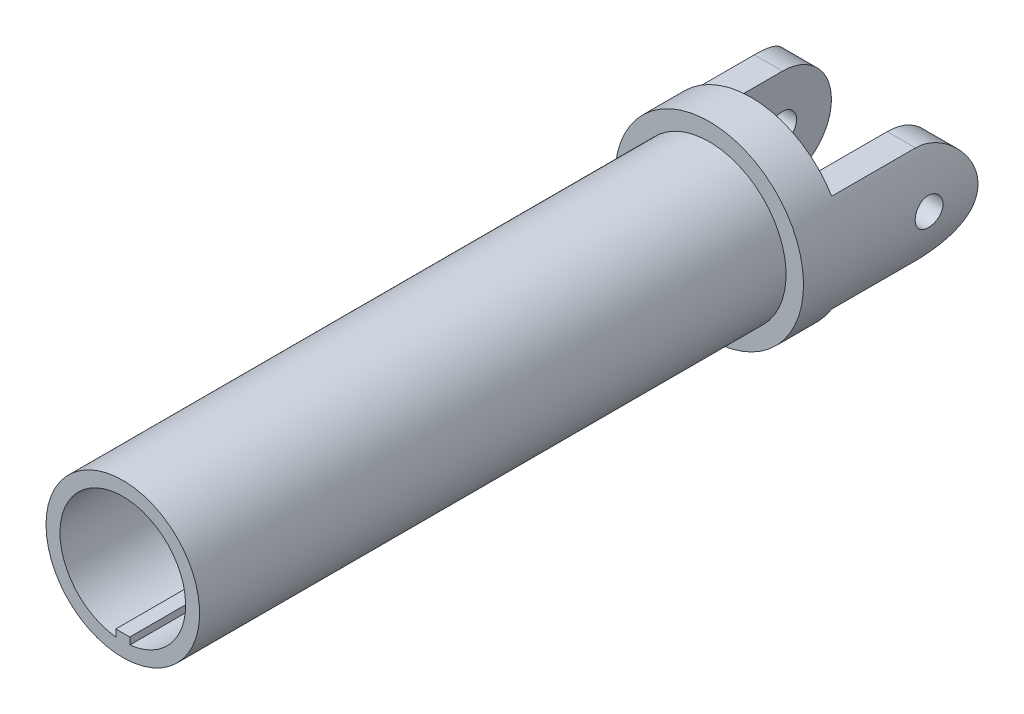
from build123d import *
from build123d.topology import SkipClean

# Parameters (mm, degrees)
SKETCH1_R                = 5.5
YOKE_DEPTH               = 21
SKETCH2_R                = 6.75
U_JOINT_BASE_DEPTH       = 3
U_JOINT_STANDUPS_DEPTH   = 9.5
STANDUP_ROUND_DEPTH      = 35.833532695
STANDUP_ROUND_DEPTH_BACK = 35.833532695
BALL_HOLES_DEPTH         = 35.83353281
BALL_HOLES_DEPTH_BACK    = 35.83353281
SKETCH5_R                = 1
KEYWAY_DEPTH             = 42


with BuildPart() as part:
    # Sketch1 → Yoke (new, symmetric)
    with BuildSketch(Plane.XY):
        Circle(SKETCH1_R)
    extrude(amount=YOKE_DEPTH, both=True)

    # Sketch2 → U Joint Base (add)
    with BuildSketch(Plane(origin=(0, 0, -21), x_dir=(-1, 0, 0), z_dir=(0, 0, -1))):
        Circle(SKETCH2_R)
    extrude(amount=U_JOINT_BASE_DEPTH)

    # Sketch3 → U Joint Standups (add)
    with SkipClean():  # the faces are left unmerged after this step: merging them gives an invalid solid
        with BuildSketch(Plane(origin=(0, 0, -24), x_dir=(-1, 0, 0), z_dir=(0, 0, -1))):
            with BuildLine():
                Line((-5.77169819, 3.5), (-3.75, 3.5))
                Line((-3.75, 3.5), (-3.75, -3.5))
                Line((-3.75, -3.5), (-5.77169819, -3.5))
                ThreePointArc((-5.77169819, -3.5), (-6.75, 0), (-5.77169819, 3.5))
            make_face()
            with BuildLine():
                Line((3.75, -3.5), (3.75, 3.5))
                Line((3.75, 3.5), (5.77169819, 3.5))
                ThreePointArc((5.77169819, 3.5), (6.75, 0), (5.77169819, -3.5))
                Line((5.77169819, -3.5), (3.75, -3.5))
            make_face()
        extrude(amount=U_JOINT_STANDUPS_DEPTH)

    # Sketch4 → Standup Round (cut, two sides: drawn at the far end of the back side and taken through both)
    with SkipClean():  # the faces are left unmerged after this step: merging them gives an invalid solid
        with BuildSketch(Plane(origin=(0, 0, 0), x_dir=(0, 0, -1), z_dir=(1, 0, 0)).offset(-STANDUP_ROUND_DEPTH_BACK)):
            with BuildLine():
                ThreePointArc((33.5, 0), (32.474873734, -2.474873734), (30, -3.5))
                Line((30, -3.5), (33.5, -3.5))
                Line((33.5, -3.5), (33.5, 0))
            make_face()
            with BuildLine():
                ThreePointArc((30, 3.5), (32.474873734, 2.474873734), (33.5, 0))
                Line((33.5, 0), (33.5, 3.5))
                Line((33.5, 3.5), (30, 3.5))
            make_face()
        extrude(amount=STANDUP_ROUND_DEPTH + STANDUP_ROUND_DEPTH_BACK, mode=Mode.SUBTRACT)

    # Sketch5 → Ball Holes (cut, two sides: drawn at the far end of the back side and taken through both)
    with SkipClean():  # the faces are left unmerged after this step: merging them gives an invalid solid
        with BuildSketch(Plane(origin=(0, 0, 0), x_dir=(0, 0, -1), z_dir=(1, 0, 0)).offset(-BALL_HOLES_DEPTH_BACK)):
            with Locations((30, 0)):
                Circle(SKETCH5_R)
        extrude(amount=BALL_HOLES_DEPTH + BALL_HOLES_DEPTH_BACK, mode=Mode.SUBTRACT)

    # Sketch6 → Keyway (cut)
    with SkipClean():  # the faces are left unmerged after this step: merging them gives an invalid solid
        with BuildSketch(Plane.XY.offset(21)):
            with BuildLine():
                Line((0.5, -4.472135955), (0.5, -3.972135955))
                Line((0.5, -3.972135955), (-0.5, -3.972135955))
                Line((-0.5, -3.972135955), (-0.5, -4.472135955))
                ThreePointArc((-0.5, -4.472135955), (0, 4.5), (0.5, -4.472135955))
            make_face()
        extrude(amount=-KEYWAY_DEPTH, mode=Mode.SUBTRACT)


solid = part.part
